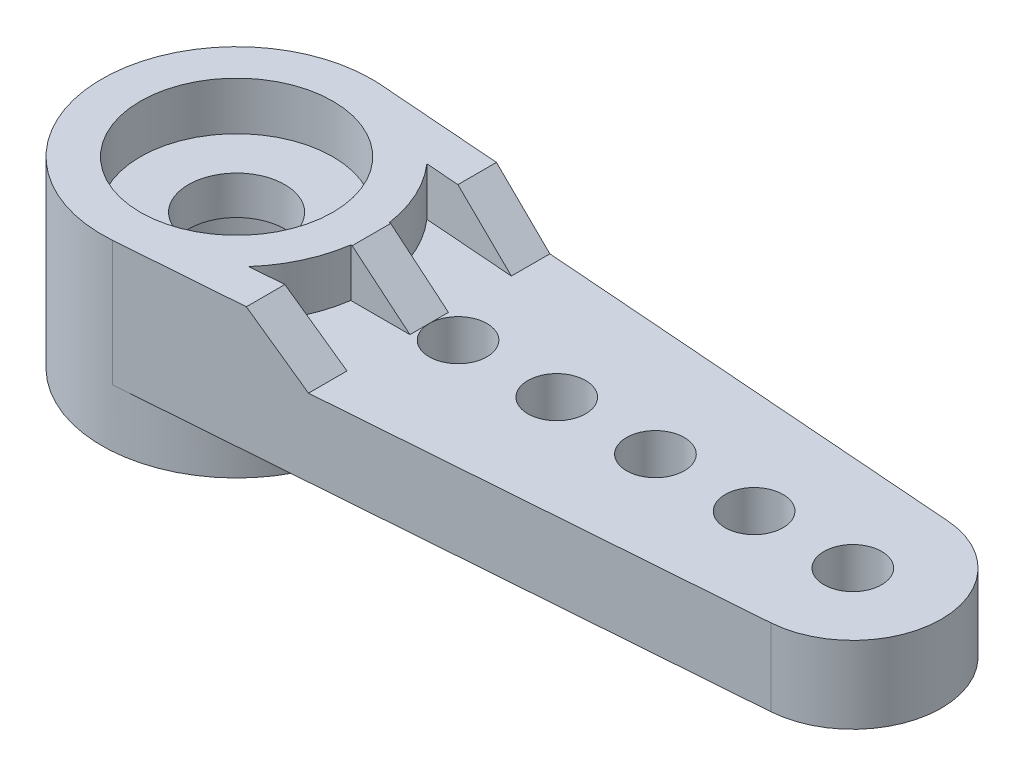
from build123d import *
from OCP.BRepFilletAPI import BRepFilletAPI_MakeChamfer
from build123d.topology import SkipClean

# Parameters (mm, degrees)
EXTRUDE_1_DEPTH      = 2
EXTRUDE_START        = 1.5
SKETCH_2_R           = 3.5
EXTRUDE_2_DEPTH      = 1.5
SKETCH_3_R           = 2.6
CUT_EXTRUDE_1_DEPTH  = 2.5
SKETCH_4_R           = 3.5
EXTRUDE_3_DEPTH      = 1.25
SKETCH_5_R           = 2.5
CUT_EXTRUDE_2_DEPTH  = 1.25
SKETCH_6_R           = 1.25
CUT_EXTRUDE_3_DEPTH  = 19.957584234
EXTRUDE_4_REACH      = 16.132
EXTRUDE_4_END_RADIUS = 3.5
SKETCH_8_W           = 1
SKETCH_8_H           = 1.25
EXTRUDE_5_DEPTH      = 1.25
CHAMFER_2_SIZE       = 1.25
CHAMFER_2_SIZE_2     = 1.5
SKETCH_10_R          = 0.75
CUT_EXTRUDE_4_DEPTH  = 19.957584234


with BuildPart() as part:
    # 草图1 → 凸台-拉伸1 (new body)
    with BuildSketch(Plane(origin=(0, 0, 0), x_dir=(1, 0, 0), z_dir=(0, 1, 0))):
        with BuildLine():
            Line((0.2625, 3.490142368), (16.1725, 2.293522128))
            ThreePointArc((16.1725, 2.293522128), (18.3, 0), (16.1725, -2.293522128))
            Line((16.1725, -2.293522128), (0.2625, -3.490142368))
            ThreePointArc((0.2625, -3.490142368), (-3.5, 0), (0.2625, 3.490142368))
        make_face()
    extrude(amount=EXTRUDE_1_DEPTH)

    # 草图2 → 凸台-拉伸2 (add)
    with BuildSketch(Plane.XZ.offset(EXTRUDE_START)):
        with Locations(Location((0, 0, 0), (0, 0, 270))):
            Circle(SKETCH_2_R)
    extrude(amount=-EXTRUDE_2_DEPTH)

    # 草图3 → 切除-拉伸1 (cut)
    with BuildSketch(Plane.XZ.offset(1.5)):
        with Locations(Location((0, 0, 0), (0, 0, 270))):
            Circle(SKETCH_3_R)
    extrude(amount=-CUT_EXTRUDE_1_DEPTH, mode=Mode.SUBTRACT)

    # 草图4 → 凸台-拉伸3 (add)
    with SkipClean():  # the faces are left unmerged after this step: merging them gives an invalid solid
        with BuildSketch(Plane(origin=(0, 2, 0), x_dir=(1, 0, 0), z_dir=(0, 1, 0))):
            with Locations(Location((0, 0, 0), (0, 0, 90))):
                Circle(SKETCH_4_R)
        extrude(amount=EXTRUDE_3_DEPTH)

    # 草图5 → 切除-拉伸2 (cut)
    with SkipClean():  # the faces are left unmerged after this step: merging them gives an invalid solid
        with BuildSketch(Plane(origin=(0, 3.25, 0), x_dir=(1, 0, 0), z_dir=(0, 1, 0))):
            with Locations(Location((0, 0, 0), (0, 0, 270))):
                Circle(SKETCH_5_R)
        extrude(amount=-CUT_EXTRUDE_2_DEPTH, mode=Mode.SUBTRACT)

    # 草图6 → 切除-拉伸3 (cut, through all)
    with SkipClean():  # the faces are left unmerged after this step: merging them gives an invalid solid
        with BuildSketch(Plane(origin=(0, 2, 0), x_dir=(1, 0, 0), z_dir=(0, 1, 0))):
            with Locations(Location((0, 0, 0), (0, 0, 270))):
                Circle(SKETCH_6_R)
        extrude(amount=-CUT_EXTRUDE_3_DEPTH, mode=Mode.SUBTRACT)

    # 凸台-拉伸4: up to this cylinder (the profile starts outside it)
    with SkipClean():  # the faces are left unmerged after this step: merging them gives an invalid solid
        extrude_4_end = Plane(origin=(0, 2.625, 0), z_dir=(0, -1, 0)) * Cylinder(EXTRUDE_4_END_RADIUS, 40.264, mode=Mode.PRIVATE)
        # 草图8 → 凸台-拉伸4 (add, up to the surface)
        with BuildSketch(Plane(origin=(5, 0, 0), x_dir=(0, 0, -1), z_dir=(1, 0, 0)), mode=Mode.PRIVATE) as extrude_4_sk1:
            with Locations((0, 2.625)):
                Rectangle(SKETCH_8_W, SKETCH_8_H)
        extrude_4_tool1 = extrude(extrude_4_sk1.sketch, amount=-EXTRUDE_4_REACH, mode=Mode.PRIVATE) - extrude_4_end
        add(extrude_4_tool1.solids().sort_by_distance((5, 2.625, 0))[0])

    # 草图9 → 凸台-拉伸5 (add)
    with SkipClean():  # the faces are left unmerged after this step: merging them gives an invalid solid
        with BuildSketch(Plane(origin=(0, 2, 0), x_dir=(1, 0, 0), z_dir=(0, 1, 0))):
            with BuildLine():
                Line((0.2625, 3.490142368), (5, 3.133826316))
                Line((5, 3.133826316), (5, 2.133826316))
                Line((5, 2.133826316), (2.627432324, 2.312271476))
                ThreePointArc((2.627432324, 2.312271476), (1.56037565, 3.1329264), (0.2625, 3.490142368))
            make_face()
            with BuildLine():
                Line((0.2625, -3.490142368), (5, -3.133826316))
                Line((5, -3.133826316), (5, -2.133826316))
                Line((5, -2.133826316), (2.627432324, -2.312271476))
                ThreePointArc((2.627432324, -2.312271476), (1.56037565, -3.1329264), (0.2625, -3.490142368))
            make_face()
        extrude(amount=EXTRUDE_5_DEPTH)

    # 倒角2
    chamfer_2_edges_1 = [part.edges().sort_by_distance(p)[0] for p in [
        (5, 3.25, 2.633826316),
    ]]
    chamfer_2_side_1 = [part.faces().sort_by_distance(p)[0] for p in [
        (5, 3.225, 2.633826316),
    ]]
    chamfer_2_edges_2 = [part.edges().sort_by_distance(p)[0] for p in [
        (5, 3.25, -2.633826316),
    ]]
    chamfer_2_side_2 = [part.faces().sort_by_distance(p)[0] for p in [
        (5, 3.225, -2.633826316),
    ]]
    chamfer_2_edges_3 = [part.edges().sort_by_distance(p)[0] for p in [
        (5, 3.25, 0),
    ]]
    chamfer_2_side_3 = [part.faces().sort_by_distance(p)[0] for p in [
        (5, 3.225, 0),
    ]]
    chamfer_2 = BRepFilletAPI_MakeChamfer(part.part.solid().wrapped)
    for e in chamfer_2_edges_1:
        chamfer_2.Add(CHAMFER_2_SIZE - 0.0001, CHAMFER_2_SIZE_2 - 0.0001, e.wrapped, chamfer_2_side_1[0].wrapped)
    for e in chamfer_2_edges_2:
        chamfer_2.Add(CHAMFER_2_SIZE - 0.0001, CHAMFER_2_SIZE_2 - 0.0001, e.wrapped, chamfer_2_side_2[0].wrapped)
    for e in chamfer_2_edges_3:
        chamfer_2.Add(CHAMFER_2_SIZE - 0.0001, CHAMFER_2_SIZE_2 - 0.0001, e.wrapped, chamfer_2_side_3[0].wrapped)
    add(Compound.cast(chamfer_2.Shape()), mode=Mode.REPLACE)  # a hair under: the kernel refuses the full size

    # 草图10 → 切除-拉伸4 (cut, through all)
    with BuildSketch(Plane(origin=(0, 2, 0), x_dir=(1, 0, 0), z_dir=(0, 1, 0))):
        with Locations(Location((5.75, 0, 0), (0, 0, 270))):
            Circle(SKETCH_10_R)
        with Locations(Location((8.3125, 0, 0), (0, 0, 270))):
            Circle(SKETCH_10_R)
        with Locations(Location((10.875, 0, 0), (0, 0, 270))):
            Circle(SKETCH_10_R)
        with Locations(Location((13.4375, 0, 0), (0, 0, 270))):
            Circle(SKETCH_10_R)
        with Locations(Location((16, 0, 0), (0, 0, 270))):
            Circle(SKETCH_10_R)
    extrude(amount=-CUT_EXTRUDE_4_DEPTH, mode=Mode.SUBTRACT)


solid = part.part
